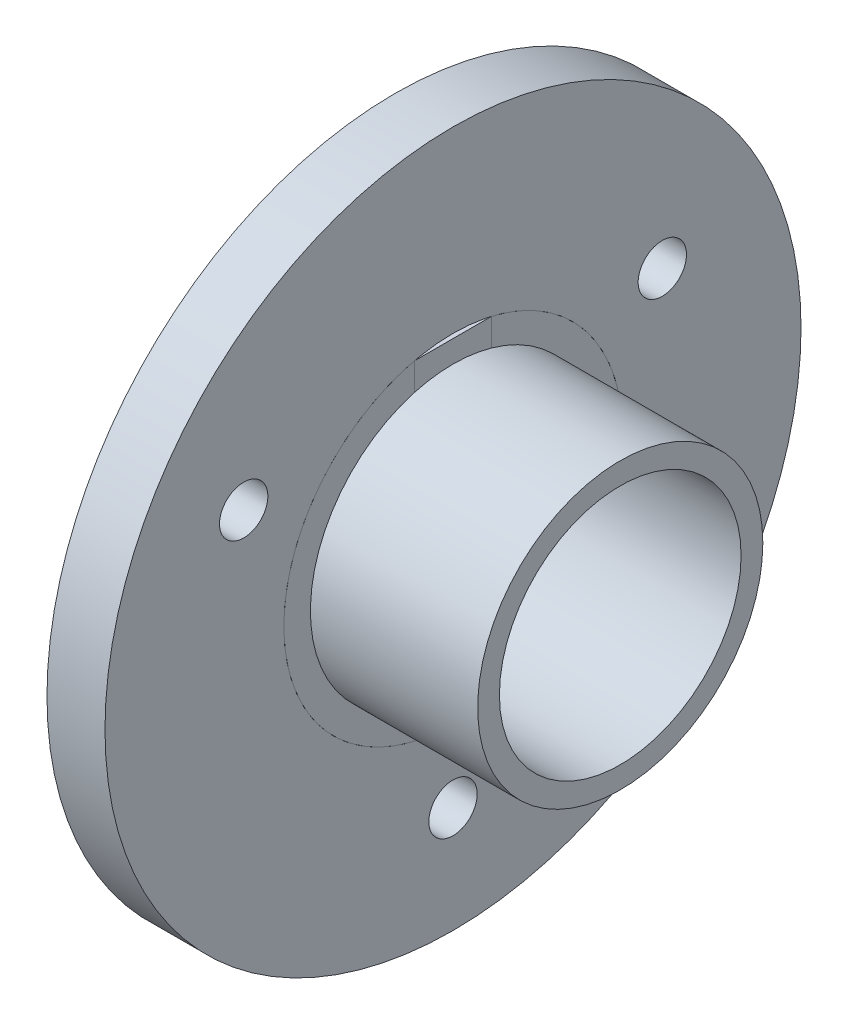
from build123d import *

# Parameters (mm, degrees)
SKETCH_2_R             = 36
SKETCH_2_R_2           = 17.5
SKETCH_2_R_3           = 2.5
SM_BASE_FLANGE_1_DEPTH = 6
CUT_EXTRUDE_START      = -16
CUT_EXTRUDE_1_DEPTH    = 16
SKETCH_9_W             = 8
SKETCH_9_H             = 8.536725037
EXTRUDE_1_DEPTH        = 16


# Sheet-metal steps are written as plain solids
with BuildPart() as part:
    # Sketch 1 → Повернуть1 (revolve)
    with BuildSketch(Plane.XY, mode=Mode.PRIVATE) as revolve_1_sk:
        Polygon((-116.05, -143.307573628), (-149.35, -143.307573628), (-149.35, -138.307573628), (-133.35, -138.307573628), (-133.35, -141.057573628), (-116.05, -141.057573628), align=None)
    revolve(revolve_1_sk.sketch.rotate(Axis((-122.60264377, -155.807573628, 0), (-1, 0, 0)), 90), axis=Axis((-122.60264377, -155.807573628, 0), (-1, 0, 0)))

    # Эскиз8 → Вырез-Вытянуть1 (cut)
    with BuildSketch(Plane.ZY.offset(149.35).offset(CUT_EXTRUDE_START)):
        with BuildLine():
            Line((-4, -138.770848591), (-4, -147.307573628))
            Line((-4, -147.307573628), (4, -147.307573628))
            Line((4, -147.307573628), (4, -138.770848591))
            ThreePointArc((4, -138.770848591), (0, -138.307573628), (-4, -138.770848591))
        make_face()
    extrude(amount=CUT_EXTRUDE_1_DEPTH, mode=Mode.SUBTRACT)


with BuildPart() as body_2:
    # Sketch 2 → Базовая кромка1 (new body)
    with BuildSketch(Plane.ZY.offset(133.35)):
        with Locations((0, -155.807573628)):
            Circle(SKETCH_2_R)
        with Locations((0, -155.807573628)):
            Circle(SKETCH_2_R_2, mode=Mode.SUBTRACT)
        with Locations((-21.650635095, -143.307573628)):
            Circle(SKETCH_2_R_3, mode=Mode.SUBTRACT)
        with Locations((0, -180.807573628)):
            Circle(SKETCH_2_R_3, mode=Mode.SUBTRACT)
        with Locations((21.650635095, -143.307573628)):
            Circle(SKETCH_2_R_3, mode=Mode.SUBTRACT)
    extrude(amount=SM_BASE_FLANGE_1_DEPTH)


with BuildPart() as body_3:
    # Эскиз9 → Бобышка-Вытянуть1 (new body)
    with BuildSketch(Plane.ZY.offset(149.35)):
        with Locations((0, -143.03921111)):
            Rectangle(SKETCH_9_W, SKETCH_9_H)
    extrude(amount=-EXTRUDE_1_DEPTH)


solid = Compound([part.part, body_2.part, body_3.part])
